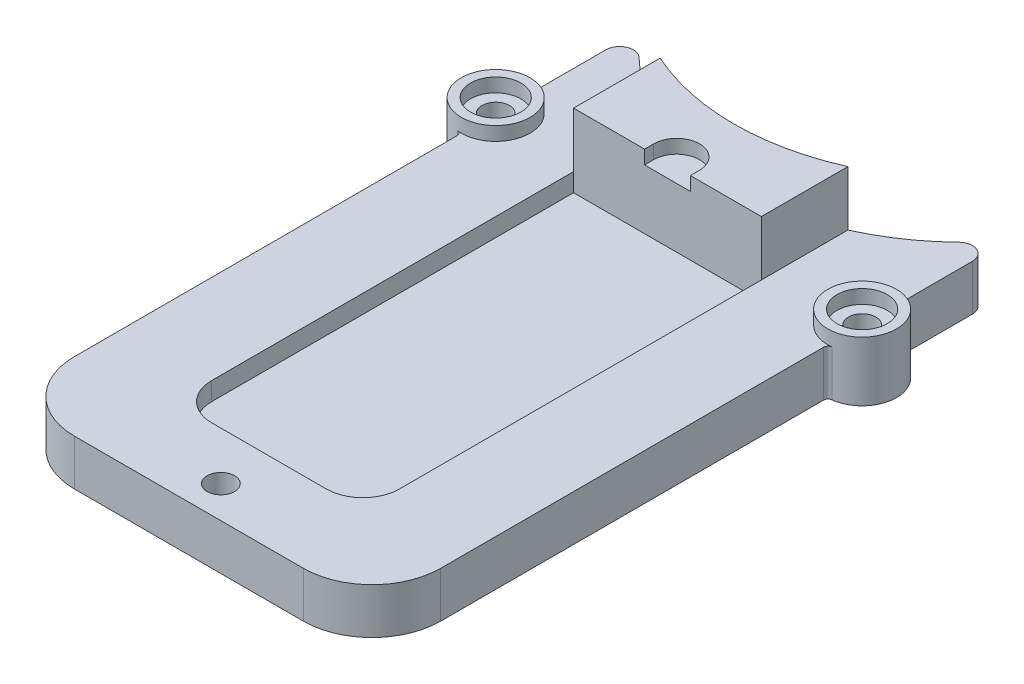
from build123d import *

# Parameters (mm, degrees)
BOSS_EXTRUDE1_DEPTH                     = 10
SKETCH2_R                               = 7.5
BOSS_EXTRUDE2_DEPTH                     = 13
BOSS_EXTRUDE3_DEPTH                     = 12
SKETCH4_W                               = 41
SKETCH4_H                               = 87
CUT_EXTRUDE1_DEPTH                      = 4
CUT_EXTRUDE2_DEPTH                      = 3
CBORE_FOR_M5_HEX_HEAD_BOLT1_D           = 6
CBORE_FOR_M5_HEX_HEAD_BOLT1_CBORE_D     = 11
CBORE_FOR_M5_HEX_HEAD_BOLT1_CBORE_DEPTH = 3
SKETCH8_R                               = 3
CUT_EXTRUDE3_DEPTH                      = 176.958091601
FILLET1_R                               = 8
FILLET2_R                               = 1


with BuildPart() as part:
    # Sketch1 → Boss-Extrude1 (new body)
    with BuildSketch(Plane(origin=(0, 0, 0), x_dir=(1, 0, 0), z_dir=(0, 1, 0))):
        with BuildLine():
            Line((25, -169), (-25, -169))
            ThreePointArc((-25, -169), (-35.606601718, -164.606601718), (-40, -154))
            Line((-40, -154), (-40, -37.947331922))
            ThreePointArc((-40, -37.947331922), (-38.165543035, -35.183003896), (-34.905660377, -35.799369738))
            ThreePointArc((-34.905660377, -35.799369738), (0, -50), (34.905660377, -35.799369738))
            ThreePointArc((34.905660377, -35.799369738), (38.165543035, -35.183003896), (40, -37.947331922))
            Line((40, -37.947331922), (40, -154))
            ThreePointArc((40, -154), (35.606601718, -164.606601718), (25, -169))
        make_face()
    extrude(amount=BOSS_EXTRUDE1_DEPTH)

    # Sketch2 → Boss-Extrude2 (add)
    with BuildSketch(Plane(origin=(0, 0, 0), x_dir=(1, 0, 0), z_dir=(0, 1, 0))):
        with Locations((40, -62)):
            Circle(SKETCH2_R)
    boss_extrude2 = extrude(amount=BOSS_EXTRUDE2_DEPTH)

    # Sketch3 → Boss-Extrude3 (add)
    with BuildSketch(Plane(origin=(0, 10, 0), x_dir=(1, 0, 0), z_dir=(0, 1, 0))):
        with BuildLine():
            Line((-20.5, -45.604276115), (-20.5, -64.5))
            Line((-20.5, -64.5), (20.5, -64.5))
            Line((20.5, -64.5), (20.5, -45.604276115))
            ThreePointArc((20.5, -45.604276115), (0, -50), (-20.5, -45.604276115))
        make_face()
    extrude(amount=BOSS_EXTRUDE3_DEPTH)

    # Sketch4 → Cut-Extrude1 (cut)
    with BuildSketch(Plane(origin=(0, 10, 0), x_dir=(1, 0, 0), z_dir=(0, 1, 0))):
        with Locations((0, -108)):
            Rectangle(SKETCH4_W, SKETCH4_H)
    extrude(amount=-CUT_EXTRUDE1_DEPTH, mode=Mode.SUBTRACT)

    # Sketch5 → Cut-Extrude2 (cut)
    with BuildSketch(Plane(origin=(0, 22, 0), x_dir=(1, 0, 0), z_dir=(0, 1, 0))):
        with BuildLine():
            Line((-5, -64.5), (-5, -62.5))
            ThreePointArc((-5, -62.5), (0, -57.5), (5, -62.5))
            Line((5, -62.5), (5, -64.5))
            Line((5, -64.5), (-5, -64.5))
        make_face()
    extrude(amount=-CUT_EXTRUDE2_DEPTH, mode=Mode.SUBTRACT)

    # CBORE for M5 Hex Head Bolt1 (through all)
    with Locations(Plane(origin=(0, 13, 0), x_dir=(1, 0, 0), z_dir=(0, 1, 0))):
        with Locations((40, -62)):
            cbore_for_m5_hex_head_bolt1 = CounterBoreHole(CBORE_FOR_M5_HEX_HEAD_BOLT1_D / 2, CBORE_FOR_M5_HEX_HEAD_BOLT1_CBORE_D / 2, CBORE_FOR_M5_HEX_HEAD_BOLT1_CBORE_DEPTH)

    # Mirror3: Boss-Extrude2, CBORE for M5 Hex Head Bolt1 across plane
    add(boss_extrude2.mirror(Plane(origin=(0, 0, 0), x_dir=(0, 0, 1), z_dir=(1, 0, 0))))
    add(cbore_for_m5_hex_head_bolt1.mirror(Plane(origin=(0, 0, 0), x_dir=(0, 0, 1), z_dir=(1, 0, 0))), mode=Mode.SUBTRACT)

    # Sketch8 → Cut-Extrude3 (cut, through all)
    with BuildSketch(Plane(origin=(0, 10, 0), x_dir=(1, 0, 0), z_dir=(0, 1, 0))):
        with Locations((0, -162)):
            Circle(SKETCH8_R)
    extrude(amount=-CUT_EXTRUDE3_DEPTH, mode=Mode.SUBTRACT)

    # Fillet1
    fillet1_edges = [part.edges().sort_by_distance(p)[0] for p in [
        (20.5, 8, 151.5),
        (-20.5, 8, 151.5),
    ]]
    fillet(fillet1_edges, radius=FILLET1_R)

    # Fillet2
    fillet2_edges = [part.edges().sort_by_distance(p)[0] for p in [
        (-40, 5, 69.5),
        (-40, 5, 54.5),
        (40, 5, 54.5),
        (40, 5, 69.5),
    ]]
    fillet(fillet2_edges, radius=FILLET2_R)


solid = part.part
